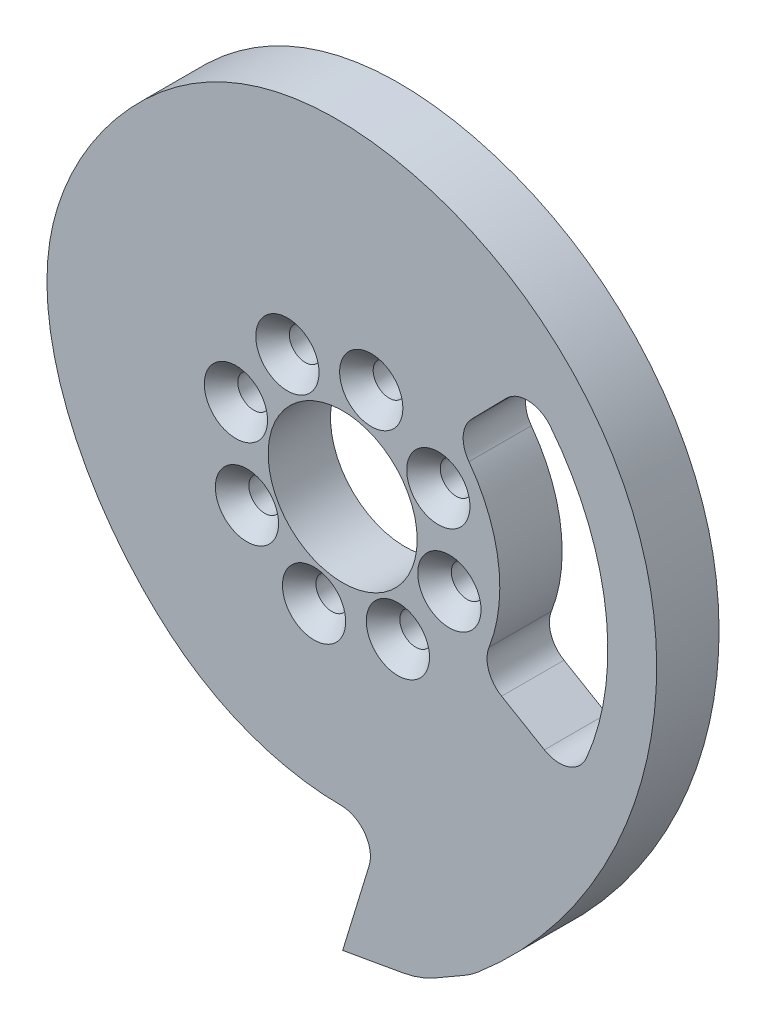
from build123d import *
from OCP.BRepFilletAPI import BRepFilletAPI_MakeFillet

# Parameters (mm, degrees)
SKETCH1_R                                        = 15.175
BOSS_EXTRUDE1_DEPTH                              = 12.7
FILLET1_R1                                       = 6
FILLET1_R2                                       = 20
CUT_EXTRUDE1_DEPTH                               = 104.201587247
FILLET2_R                                        = 6
CSK_FOR_1_4_FLAT_HEAD_MACHINE_SCREW1_D           = 6.5278
CSK_FOR_1_4_FLAT_HEAD_MACHINE_SCREW1_DEPTH       = 54.11
CSK_FOR_1_4_FLAT_HEAD_MACHINE_SCREW1_CSINK_D     = 12.8778
CSK_FOR_1_4_FLAT_HEAD_MACHINE_SCREW1_CSINK_ANGLE = 82
CSK_FOR_1_4_FLAT_HEAD_MACHINE_SCREW1_TIP         = 1.961148974


with BuildPart() as part:
    # Sketch1 → Boss-Extrude1 (new body)
    with BuildSketch(Plane.XY):
        with BuildLine():
            ThreePointArc((-35.096203489, -41.826026594), (-14.882541152, -52.532561035), (7.943149159, -54.019129773))
            Line((7.943149159, -54.019129773), (0, -80))
            Line((0, -80), (15.756924048, -77.221629157))
            Line((15.756924048, -77.221629157), (26.149228894, -71.221629157))
            add(Edge.make_bspline(
                [(26.149228894, -71.221629157), (56.511514722, -46.299516498), (79.066882636, 17.699886927), (26.752965295, 69.514581778), (-31.959643857, 66.351208139), (-71.221759252, 10.235899926), (-51.522875219, -28.042412404), (-35.096203489, -41.826026594)],
                knots=[0, 0, 0, 0, 0.320521396, 0.565793749, 0.734822836, 0.843782163, 1, 1, 1, 1], degree=3))
        make_face()
        Circle(SKETCH1_R, mode=Mode.SUBTRACT)
    extrude(amount=BOSS_EXTRUDE1_DEPTH)

    # Fillet1: one fillet with a radius per group of edges: ONE call of the kernel's fillet builder (fillet() takes one radius for all edges)
    fillet1_edges_1 = [part.edges().sort_by_distance(p)[0] for p in [
        (7.943149159, -54.019129773, 6.35),
    ]]
    fillet1_edges_2 = [part.edges().sort_by_distance(p)[0] for p in [
        (15.756924048, -77.221629157, 6.35),
        (26.149228894, -71.221629157, 6.35),
    ]]
    fillet1 = BRepFilletAPI_MakeFillet(part.part.solid().wrapped)
    for e in fillet1_edges_1:
        fillet1.Add(FILLET1_R1, e.wrapped)
    for e in fillet1_edges_2:
        fillet1.Add(FILLET1_R2, e.wrapped)
    add(Compound.cast(fillet1.Shape()), mode=Mode.REPLACE)

    # Sketch2 → Cut-Extrude1 (cut, through all)
    with BuildSketch(Plane.XY.offset(12.7)):
        with BuildLine():
            Line((37.778324307, 38.584948005), (22.387155145, 22.865154373))
            ThreePointArc((22.387155145, 22.865154373), (31.718513672, 4.235078564), (27.601904579, -16.190579471))
            Line((27.601904579, -16.190579471), (46.578213977, -27.321602858))
            ThreePointArc((46.578213977, -27.321602858), (53.524991821, 7.146695077), (37.778324307, 38.584948005))
        make_face()
    extrude(amount=-CUT_EXTRUDE1_DEPTH, mode=Mode.SUBTRACT)

    # Fillet2
    fillet2_edges = [part.edges().sort_by_distance(p)[0] for p in [
        (27.601904579, -16.190579471, 6.35),
        (37.778324307, 38.584948005, 6.35),
        (46.578213977, -27.321602858, 6.35),
        (22.387155145, 22.865154373, 6.35),
    ]]
    fillet(fillet2_edges, radius=FILLET2_R)

    # CSK for 1/4 Flat Head Machine Screw1
    with Locations(Plane.XY.offset(12.7)):
        with Locations((19.485571585, 11.25), (21.733331092, -5.823428515), (11.25, -19.485571585), (-5.823428515, -21.733331092), (-11.25, 19.485571585), (5.823428515, 21.733331092), (-19.485571585, -11.25), (-21.733331092, 5.823428515)):
            CounterSinkHole(CSK_FOR_1_4_FLAT_HEAD_MACHINE_SCREW1_D / 2, CSK_FOR_1_4_FLAT_HEAD_MACHINE_SCREW1_CSINK_D / 2, depth=CSK_FOR_1_4_FLAT_HEAD_MACHINE_SCREW1_DEPTH, counter_sink_angle=CSK_FOR_1_4_FLAT_HEAD_MACHINE_SCREW1_CSINK_ANGLE)
            with Locations((0, 0, -(CSK_FOR_1_4_FLAT_HEAD_MACHINE_SCREW1_DEPTH + CSK_FOR_1_4_FLAT_HEAD_MACHINE_SCREW1_TIP / 2))):  # 118° drill point
                Cone(0, CSK_FOR_1_4_FLAT_HEAD_MACHINE_SCREW1_D / 2, CSK_FOR_1_4_FLAT_HEAD_MACHINE_SCREW1_TIP, mode=Mode.SUBTRACT)


solid = part.part
